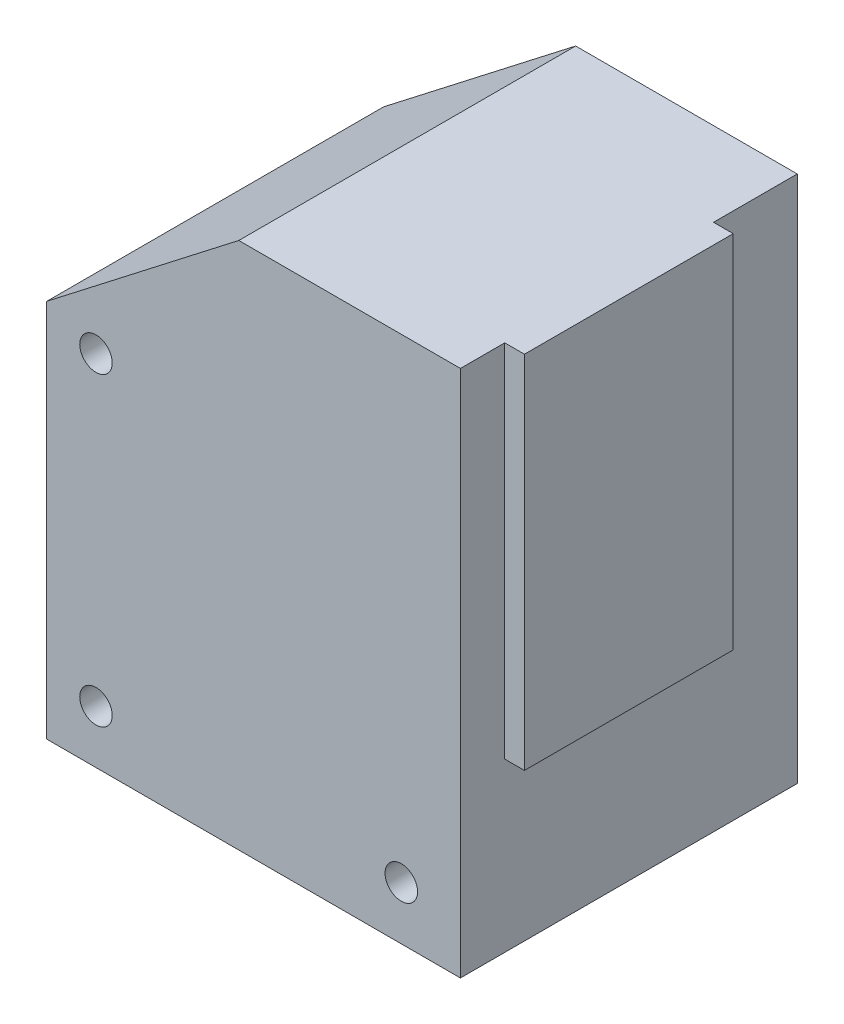
from build123d import *

# Parameters (mm, degrees)
BOSS_EXTRUDE1_DEPTH = 34.2
SKETCH2_R           = 8
CUT_EXTRUDE1_DEPTH  = 10
SKETCH3_W           = 21.2
SKETCH3_H           = 36.6
BOSS_EXTRUDE2_DEPTH = 2
SKETCH5_R           = 1.65
CUT_EXTRUDE4_DEPTH  = 78.321407126


with BuildPart() as part:
    # Sketch1 → Boss-Extrude1 (new body)
    with BuildSketch(Plane.XY):
        Polygon((0, 38.5), (19.5, 53.6), (42, 53.6), (42, 0), (0, 0), align=None)
    extrude(amount=BOSS_EXTRUDE1_DEPTH)

    # Sketch2 → Cut-Extrude1 (cut)
    with BuildSketch(Plane.XZ):
        with Locations((26, 23.7)):
            Circle(SKETCH2_R)
    extrude(amount=-CUT_EXTRUDE1_DEPTH, mode=Mode.SUBTRACT)

    # Sketch3 → Boss-Extrude2 (add)
    with BuildSketch(Plane(origin=(42, 0, 0), x_dir=(0, 0, -1), z_dir=(1, 0, 0))):
        with Locations((-19.1, 35.3)):
            Rectangle(SKETCH3_W, SKETCH3_H)
    extrude(amount=BOSS_EXTRUDE2_DEPTH)

    # Sketch5 → Cut-Extrude4 (cut, through all)
    with BuildSketch(Plane(origin=(0, 0, 0), x_dir=(-1, 0, 0), z_dir=(0, 0, -1))):
        with Locations((-36, 5.4)):
            Circle(SKETCH5_R)
        with Locations((-5, 5.4)):
            Circle(SKETCH5_R)
        with Locations((-5, 36.4)):
            Circle(SKETCH5_R)
    extrude(amount=-CUT_EXTRUDE4_DEPTH, mode=Mode.SUBTRACT)


solid = part.part
